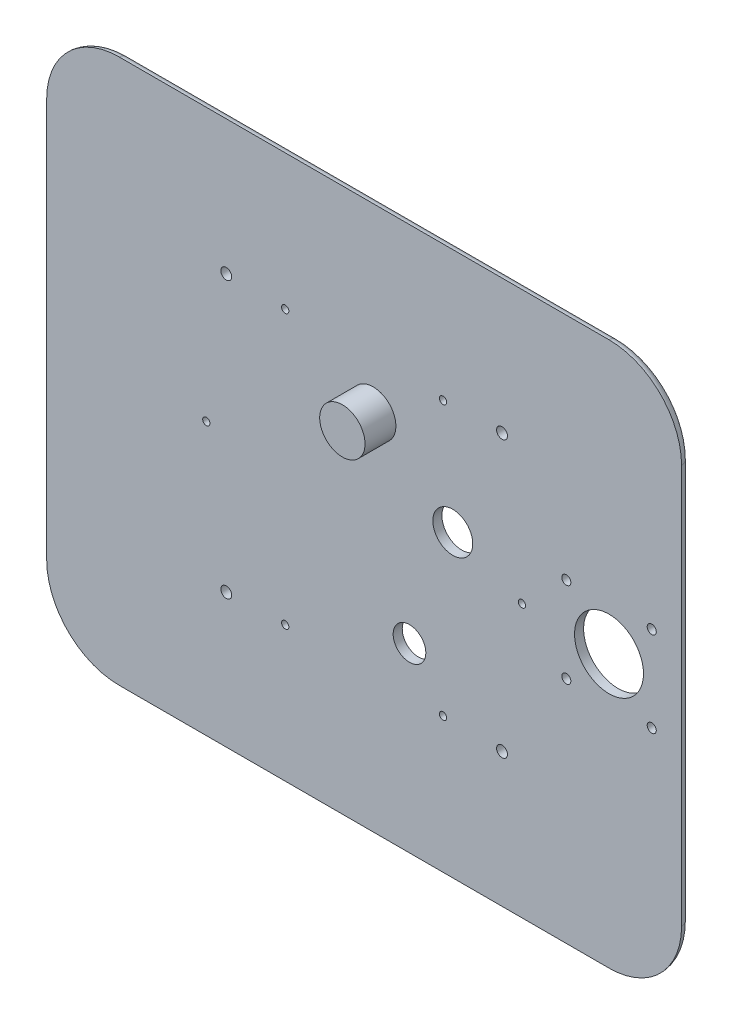
from build123d import *

# Parameters (mm, degrees)
SKETCH1_W           = 350
SKETCH1_H           = 300
SKETCH1_R           = 2
SKETCH1_R_2         = 3
SKETCH1_R_3         = 19
SKETCH1_R_4         = 2.5
BOSS_EXTRUDE1_DEPTH = 5
CUT_EXTRUDE1_REACH  = 232.543
SKETCH2_R           = 11
SKETCH2_R_2         = 9
SKETCH2_R_3         = 10
FILLET1_R           = 40
FILLET2_R           = 5
SKETCH3_R           = 12.5
SKETCH3_R_2         = 10
BOSS_EXTRUDE2_DEPTH = 15
SKETCH4_R           = 12.5
BOSS_EXTRUDE3_DEPTH = 2


with BuildPart() as part:
    # Sketch1 → Boss-Extrude1 (new body)
    with BuildSketch(Plane.XY):
        Rectangle(SKETCH1_W, SKETCH1_H)
        with Locations((-43.5, 75.344210129)):
            Circle(SKETCH1_R, mode=Mode.SUBTRACT)
        with Locations((43.5, 75.344210129)):
            Circle(SKETCH1_R, mode=Mode.SUBTRACT)
        with Locations((87, 0)):
            Circle(SKETCH1_R, mode=Mode.SUBTRACT)
        with Locations((43.5, -75.344210129)):
            Circle(SKETCH1_R, mode=Mode.SUBTRACT)
        with Locations((-43.5, -75.344210129)):
            Circle(SKETCH1_R, mode=Mode.SUBTRACT)
        with Locations((-87, 0)):
            Circle(SKETCH1_R, mode=Mode.SUBTRACT)
        with Locations((-76.012957941, -76.015)):
            Circle(SKETCH1_R_2, mode=Mode.SUBTRACT)
        with Locations((76.012957941, 76.015)):
            Circle(SKETCH1_R_2, mode=Mode.SUBTRACT)
        with Locations((76.012957941, -76.015)):
            Circle(SKETCH1_R_2, mode=Mode.SUBTRACT)
        with Locations((-76.012957941, 76.015)):
            Circle(SKETCH1_R_2, mode=Mode.SUBTRACT)
        with Locations((135, 0)):
            Circle(SKETCH1_R_3, mode=Mode.SUBTRACT)
        with Locations((158.55, -23.55)):
            Circle(SKETCH1_R_4, mode=Mode.SUBTRACT)
        with Locations((111.45, -23.55)):
            Circle(SKETCH1_R_4, mode=Mode.SUBTRACT)
        with Locations((111.45, 23.55)):
            Circle(SKETCH1_R_4, mode=Mode.SUBTRACT)
        with Locations((158.55, 23.55)):
            Circle(SKETCH1_R_4, mode=Mode.SUBTRACT)
    extrude(amount=BOSS_EXTRUDE1_DEPTH)

    # Sketch2 → Cut-Extrude1 (cut, up to next)
    with BuildSketch(Plane(origin=(0, 0, 0), x_dir=(-1, 0, 0), z_dir=(0, 0, -1)), mode=Mode.PRIVATE) as cut_extrude1_sk1:
        with Locations((-48.87, 15)):
            Circle(SKETCH2_R)
    cut_extrude1_tool1 = extrude(cut_extrude1_sk1.sketch, amount=-CUT_EXTRUDE1_REACH, mode=Mode.PRIVATE) & part.part
    # Sketch2 → Cut-Extrude1 (cut, up to next)
    with BuildSketch(Plane(origin=(0, 0, 0), x_dir=(-1, 0, 0), z_dir=(0, 0, -1)), mode=Mode.PRIVATE) as cut_extrude1_sk2:
        with Locations((-25, -50)):
            Circle(SKETCH2_R_2)
    cut_extrude1_tool2 = extrude(cut_extrude1_sk2.sketch, amount=-CUT_EXTRUDE1_REACH, mode=Mode.PRIVATE) & part.part
    # Sketch2 → Cut-Extrude1 (cut, up to next)
    with BuildSketch(Plane(origin=(0, 0, 0), x_dir=(-1, 0, 0), z_dir=(0, 0, -1)), mode=Mode.PRIVATE) as cut_extrude1_sk3:
        with Locations((-5, 50)):
            Circle(SKETCH2_R_3)
    cut_extrude1_tool3 = extrude(cut_extrude1_sk3.sketch, amount=-CUT_EXTRUDE1_REACH, mode=Mode.PRIVATE) & part.part
    add(cut_extrude1_tool1.solids().sort_by_distance((48.87, 15, 0))[0], mode=Mode.SUBTRACT)
    add(cut_extrude1_tool2.solids().sort_by_distance((25, -50, 0))[0], mode=Mode.SUBTRACT)
    add(cut_extrude1_tool3.solids().sort_by_distance((5, 50, 0))[0], mode=Mode.SUBTRACT)

    # Fillet1
    fillet1_edges = [part.edges().sort_by_distance(p)[0] for p in [
        (175, -150, 2.5),
        (-175, -150, 2.5),
        (-175, 150, 2.5),
        (175, 150, 2.5),
    ]]
    fillet(fillet1_edges, radius=FILLET1_R)

    # Fillet2
    fillet2_edges = [part.edges().sort_by_distance(p)[0] for p in [
        (163.284271247, 138.284271247, 0),
        (175, 0, 0),
        (163.284271247, -138.284271247, 0),
        (0, -150, 0),
        (-163.284271247, -138.284271247, 0),
        (-175, 0, 0),
        (-163.284271247, 138.284271247, 0),
        (0, 150, 0),
    ]]
    fillet(fillet2_edges, radius=FILLET2_R - 0.0001)  # a hair under: the kernel refuses the full size

    # Sketch3 → Boss-Extrude2 (add)
    with BuildSketch(Plane.XY.offset(5)):
        with Locations((5, 50)):
            Circle(SKETCH3_R)
        with Locations(Location((5, 50, 0), (0, 0, 180))):
            Circle(SKETCH3_R_2, mode=Mode.SUBTRACT)
    extrude(amount=BOSS_EXTRUDE2_DEPTH)

    # Sketch4 → Boss-Extrude3 (add)
    with BuildSketch(Plane.XY.offset(20)):
        with Locations((5, 50)):
            Circle(SKETCH4_R)
    extrude(amount=BOSS_EXTRUDE3_DEPTH)


solid = part.part
